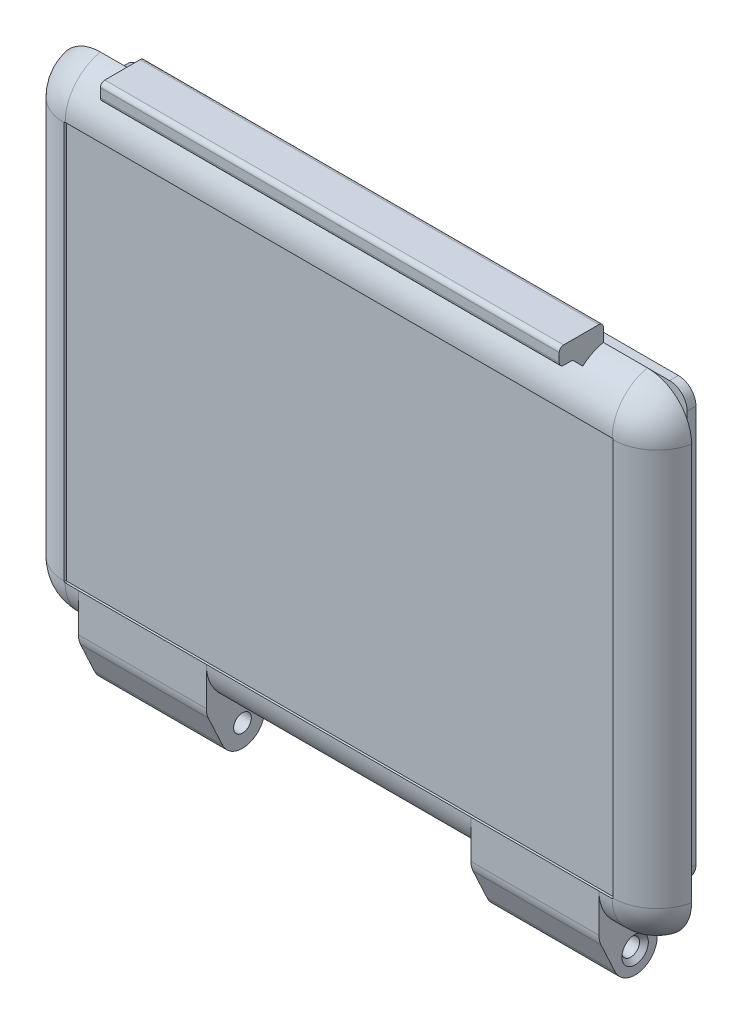
from build123d import *

# Parameters (mm, degrees)
SKETCH1_W           = 72
SKETCH1_H           = 55
BOSS_EXTRUDE1_DEPTH = 4
FILLET3_R           = 5
FILLET4_R           = 5
CUT_EXTRUDE1_DEPTH  = 0.25
SKETCH3_W           = 62
SKETCH3_H           = 46
SKETCH3_W_2         = 60
SKETCH3_H_2         = 44
BOSS_EXTRUDE2_DEPTH = 4
SKETCH4_W           = 65
SKETCH4_H           = 49
SKETCH4_W_2         = 60
SKETCH4_H_2         = 44
BOSS_EXTRUDE3_DEPTH = 1
FILLET2_R           = 2
BOSS_EXTRUDE4_DEPTH = 0.5
BOSS_EXTRUDE5_DEPTH = 26
SKETCH7_R           = 1
BOSS_EXTRUDE6_DEPTH = 29.5
CUT_EXTRUDE2_DEPTH  = 15
CHAMFER1_SIZE       = 0.5


with BuildPart() as part:
    # Sketch1 → Boss-Extrude1 (new body)
    with BuildSketch(Plane.XY):
        Rectangle(SKETCH1_W, SKETCH1_H)
    extrude(amount=BOSS_EXTRUDE1_DEPTH)

    # Fillet3
    fillet3_edges = [part.edges().sort_by_distance(p)[0] for p in [
        (36, -27.5, 2),
        (-36, -27.5, 2),
        (-36, 27.5, 2),
        (36, 27.5, 2),
    ]]
    fillet(fillet3_edges, radius=FILLET3_R)

    # Fillet4
    # the kernel refuses this fillet: 5 mm, written as the material it takes off along each edge
    with BuildSketch(Plane(origin=(31, 22.5, 4), x_dir=(1, 0, 0), z_dir=(0, -1, 0))) as fillet4_piece_1:
        with BuildLine():
            CenterArc((0.101020514, -5), FILLET4_R, 11.536959033, 78.463040967)
            Line((5, -4), (5.09797959, -3.98))
            ThreePointArc((5.09797959, -3.98), (5.1, -2), (5.1, 0))
            Line((5.1, 0), (5, 0.1))
            Line((5, 0.1), (0.101020514, 0.1))
            Line((0.101020514, 0.1), (0.101020514, 0))
        make_face()
    revolve(axis=Axis((31, 22.5, 4), (0, 0, 1)), revolution_arc=90, mode=Mode.SUBTRACT)
    with BuildSketch(Plane(origin=(36, -22.5, 4), x_dir=(-1, 0, 0), z_dir=(0, 1, 0)), Plane(origin=(-36, 22.5, 4), x_dir=(1, 0, 0), z_dir=(0, -1, 0))) as fillet4_piece_2:
        with BuildLine():
            CenterArc((4.898979486, -5), FILLET4_R, 90, 78.463040967)
            Line((0, -4), (-0.09797959, -3.98))
            ThreePointArc((-0.09797959, -3.98), (-0.1, -2), (-0.1, 0))
            Line((-0.1, 0), (0, 0.1))
            Line((0, 0.1), (4.898979486, 0.1))
            Line((4.898979486, 0.1), (4.898979486, 0))
        make_face()
    extrude(amount=45, mode=Mode.SUBTRACT)
    with BuildSketch(Plane(origin=(31, -22.5, 4), x_dir=(0, -1, 0), z_dir=(-1, 0, 0))) as fillet4_piece_3:
        with BuildLine():
            CenterArc((0.101020514, -5), FILLET4_R, 11.536959033, 78.463040967)
            Line((0.101020514, 0), (0.101020514, 0.1))
            Line((0.101020514, 0.1), (5, 0.1))
            Line((5, 0.1), (5.1, 0))
            ThreePointArc((5.1, 0), (5.1, -2), (5.09797959, -3.98))
            Line((5.09797959, -3.98), (5, -4))
        make_face()
    revolve(axis=Axis((31, -22.5, 4), (0, 0, 1)), revolution_arc=90, mode=Mode.SUBTRACT)
    with BuildSketch(Plane(origin=(-31, -27.5, 4), x_dir=(0, 1.564970375511121e-12, -1.0), z_dir=(1, 0, 0))) as fillet4_piece_4:
        with BuildLine():
            CenterArc((5, 4.898979486), FILLET4_R, 180, 78.463040967)
            Line((0, 4.898979486), (-0.1, 4.898979486))
            Line((-0.1, 4.898979486), (-0.1, 0))
            Line((-0.1, 0), (0, -0.1))
            ThreePointArc((0, -0.1), (2, -0.1), (3.98, -0.09797959))
            Line((3.98, -0.09797959), (4, 0))
        make_face()
    extrude(amount=62, mode=Mode.SUBTRACT)
    with BuildSketch(Plane(origin=(-31, -22.5, 4), x_dir=(0, -1, 0), z_dir=(1, 0, 0))) as fillet4_piece_5:
        with BuildLine():
            CenterArc((0.101020514, 5), FILLET4_R, 270, 78.463040967)
            Line((0.101020514, 0), (0.101020514, -0.1))
            Line((0.101020514, -0.1), (5, -0.1))
            Line((5, -0.1), (5.1, 0))
            ThreePointArc((5.1, 0), (5.1, 2), (5.09797959, 3.98))
            Line((5.09797959, 3.98), (5, 4))
        make_face()
    revolve(axis=Axis((-31, -22.5, 4), (0, 0, -1)), revolution_arc=90, mode=Mode.SUBTRACT)
    with BuildSketch(Plane(origin=(-31, 22.5, 4), x_dir=(0, 1, 0), z_dir=(1, 0, 0))) as fillet4_piece_6:
        with BuildLine():
            CenterArc((0.101020514, -5), FILLET4_R, 11.536959033, 78.463040967)
            Line((5, -4), (5.09797959, -3.98))
            ThreePointArc((5.09797959, -3.98), (5.1, -2), (5.1, 0))
            Line((5.1, 0), (5, 0.1))
            Line((5, 0.1), (0.101020514, 0.1))
            Line((0.101020514, 0.1), (0.101020514, 0))
        make_face()
    revolve(axis=Axis((-31, 22.5, 4), (0, 0, 1)), revolution_arc=90, mode=Mode.SUBTRACT)
    with BuildSketch(Plane(origin=(31, 27.5, 4), x_dir=(0, -1, 0), z_dir=(-1, 0, 0))) as fillet4_piece_7:
        with BuildLine():
            CenterArc((4.898979486, -5), FILLET4_R, 90, 78.463040967)
            Line((0, -4), (-0.09797959, -3.98))
            ThreePointArc((-0.09797959, -3.98), (-0.1, -2), (-0.1, 0))
            Line((-0.1, 0), (0, 0.1))
            Line((0, 0.1), (4.898979486, 0.1))
            Line((4.898979486, 0.1), (4.898979486, 0))
        make_face()
    extrude(amount=62, mode=Mode.SUBTRACT)

    # Sketch2 → Cut-Extrude1 (cut)
    with BuildSketch(Plane.XY.offset(4)):
        with BuildLine():
            Line((31.101020514, -22.5), (31.101020514, 22.5))
            ThreePointArc((31.101020514, 22.5), (31.071432291, 22.571432291), (31, 22.601020514))
            Line((31, 22.601020514), (-31, 22.601020514))
            ThreePointArc((-31, 22.601020514), (-31.071432291, 22.571432291), (-31.101020514, 22.5))
            Line((-31.101020514, 22.5), (-31.101020514, -22.5))
            ThreePointArc((-31.101020514, -22.5), (-31.071432291, -22.571432291), (-31, -22.601020514))
            Line((-31, -22.601020514), (31, -22.601020514))
            ThreePointArc((31, -22.601020514), (31.071432291, -22.571432291), (31.101020514, -22.5))
        make_face()
    extrude(amount=-CUT_EXTRUDE1_DEPTH, mode=Mode.SUBTRACT)

    # Sketch3 → Boss-Extrude2 (add)
    with BuildSketch(Plane(origin=(0, 0, 0), x_dir=(-1, 0, 0), z_dir=(0, 0, -1))):
        Rectangle(SKETCH3_W, SKETCH3_H)
        Rectangle(SKETCH3_W_2, SKETCH3_H_2, mode=Mode.SUBTRACT)
    extrude(amount=BOSS_EXTRUDE2_DEPTH)

    # Sketch4 → Boss-Extrude3 (add)
    with BuildSketch(Plane(origin=(0, 0, -4), x_dir=(-1, 0, 0), z_dir=(0, 0, -1))):
        Rectangle(SKETCH4_W, SKETCH4_H)
        Rectangle(SKETCH4_W_2, SKETCH4_H_2, mode=Mode.SUBTRACT)
    extrude(amount=-BOSS_EXTRUDE3_DEPTH)

    # Fillet2
    fillet2_edges = [part.edges().sort_by_distance(p)[0] for p in [
        (31, 23, -1.5),
        (-31, 23, -1.5),
        (-31, -23, -1.5),
        (31, -23, -1.5),
        (32.5, 24.5, -3.5),
        (-32.5, 24.5, -3.5),
        (-32.5, -24.5, -3.5),
        (32.5, -24.5, -3.5),
        (-30, 22, -2),
        (30, 22, -2),
        (30, -22, -2),
        (-30, -22, -2),
    ]]
    fillet(fillet2_edges, radius=FILLET2_R)

    # Sketch5 → Boss-Extrude4 (add)
    with BuildSketch(Plane(origin=(0, 0, 0), x_dir=(-1, 0, 0), z_dir=(0, 0, -1))):
        with BuildLine():
            Line((-15, 7), (15, 7))
            ThreePointArc((15, 7), (22, 0), (15, -7))
            Line((15, -7), (-15, -7))
            ThreePointArc((-15, -7), (-22, 0), (-15, 7))
        make_face()
        with BuildLine():
            Line((-15, 5.5), (15, 5.5))
            ThreePointArc((15, 5.5), (20.5, 0), (15, -5.5))
            Line((15, -5.5), (-15, -5.5))
            ThreePointArc((-15, -5.5), (-20.5, 0), (-15, 5.5))
        make_face(mode=Mode.SUBTRACT)
    extrude(amount=BOSS_EXTRUDE4_DEPTH)

    # Sketch6 → Boss-Extrude5 (add, symmetric)
    with BuildSketch(Plane(origin=(0, 0, 0), x_dir=(0, 0, -1), z_dir=(1, 0, 0))):
        with BuildLine():
            Line((0, 27.5), (0, 29))
            ThreePointArc((0, 29), (-0.146446609, 29.353553391), (-0.5, 29.5))
            Line((-0.5, 29.5), (-4.5, 29.5))
            ThreePointArc((-4.5, 29.5), (-4.853553391, 29.353553391), (-5, 29))
            Line((-5, 29), (-5, 28))
            ThreePointArc((-5, 28), (-4.853553391, 27.646446609), (-4.5, 27.5))
            Line((-4.5, 27.5), (-3.707106781, 27.5))
            ThreePointArc((-3.707106781, 27.5), (-3.515765065, 27.461939766), (-3.353553391, 27.353553391))
            Line((-3.353553391, 27.353553391), (-1.948480403, 25.948480403))
            Line((-1.948480403, 25.948480403), (0, 25.948480403))
            Line((0, 25.948480403), (0, 27.5))
        make_face()
    extrude(amount=BOSS_EXTRUDE5_DEPTH, both=True)

    # Sketch7 → Boss-Extrude6 (add, symmetric)
    with BuildSketch(Plane(origin=(0, 0, 0), x_dir=(0, 0, -1), z_dir=(1, 0, 0))):
        with BuildLine():
            Line((-2.16812286, -31.451484043), (-3.76812286, -28.00017482))
            ThreePointArc((-3.76812286, -28.00017482), (-3.941342576, -27.487064649), (-4, -26.948690777))
            Line((-4, -26.948690777), (-4, -22.601020514))
            ThreePointArc((-4, -22.601020514), (-2.872983346, -25.763298175), (0, -27.5))
            Line((0, -27.5), (0.1, -27.9))
            ThreePointArc((0.1, -27.9), (2.206977706, -31.745602076), (-2.16812286, -31.451484043))
        make_face()
        with Locations((0.1, -30.4)):
            Circle(SKETCH7_R, mode=Mode.SUBTRACT)
    extrude(amount=BOSS_EXTRUDE6_DEPTH, both=True)

    # Sketch8 → Cut-Extrude2 (cut, symmetric)
    with BuildSketch(Plane(origin=(0, 0, 0), x_dir=(0, 0, -1), z_dir=(1, 0, 0))):
        with BuildLine():
            Line((0.1, -27.9), (0, -27.5))
            ThreePointArc((0, -27.5), (-2.872983346, -25.763298175), (-4, -22.601020514))
            Line((-4, -22.601020514), (-4, -26.948690777))
            ThreePointArc((-4, -26.948690777), (-3.941342576, -27.487064649), (-3.76812286, -28.00017482))
            Line((-3.76812286, -28.00017482), (-2.16812286, -31.451484043))
            ThreePointArc((-2.16812286, -31.451484043), (2.206977706, -31.745602076), (0.1, -27.9))
        make_face()
    extrude(amount=CUT_EXTRUDE2_DEPTH, both=True, mode=Mode.SUBTRACT)

    # Chamfer1
    chamfer1_edges = [part.edges().sort_by_distance(p)[0] for p in [
        (-29.5, -30.4, 0.9),
        (29.5, -30.4, 0.9),
    ]]
    chamfer(chamfer1_edges, length=CHAMFER1_SIZE)


solid = part.part
